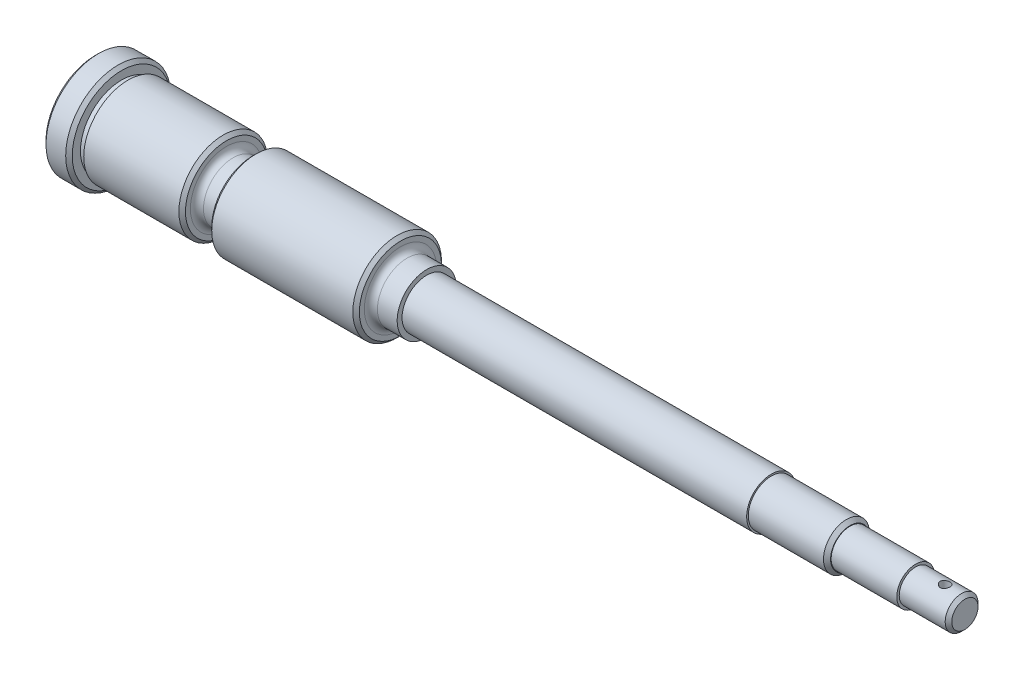
from build123d import *

# Parameters (mm, degrees)
CHAMFER_1_SIZE = 1
FILLET_1_R     = 2
FILLET_2_R     = 2


# Read off the part's stored shape, not the designer's step: M14 机械螺纹 螺柱1
with BuildPart() as part:
    # 草图1 → 旋转1 (revolve)
    with BuildSketch(Plane.XY, mode=Mode.PRIVATE) as revolve_1_sk:
        Polygon((0, 0), (0, 16), (8, 16), (8, 12.5), (10, 12.5), (10, 13.5), (40, 13.5), (40, 9), (48, 9), (48, 13.5), (93, 13.5), (93, 9), (101, 9), (101, 7.5), (230, 7.5), (230, 5.75), (250, 5.75), (250, 5), (265, 5), (265, 0), align=None)
    revolve(revolve_1_sk.sketch.rotate(Axis((0, 0, 0), (1, 0, 0)), 90), axis=Axis((0, 0, 0), (1, 0, 0)))

    # M14 机械螺纹 螺柱1 outline → M14 机械螺纹 螺柱1 (revolve, cut)
    with BuildSketch(Plane.YX):
        Polygon((7.5, 230), (5.9175, 230), (7, 228.9175), (7, 206), (7.5, 206), align=None)
    revolve(axis=Axis((0, 0, 0), (1, 0, 0)), mode=Mode.SUBTRACT)

    # 草图3 → 切除-旋转1 (revolve, cut)
    with BuildSketch(Plane.XY, mode=Mode.PRIVATE) as cut_revolve_1_sk:
        Polygon((259, -5.697872022), (260.4, -5.697872022), (260.5, 5.677594139), (259, 5.677594139), align=None)
    revolve(cut_revolve_1_sk.sketch.rotate(Axis((259, -22.643842163, 0), (0, 1, 0)), 131.522767303), axis=Axis((259, -22.643842163, 0), (0, 1, 0)), mode=Mode.SUBTRACT)

    # 倒角1
    chamfer_1_edges = [part.edges().sort_by_distance(p)[0] for p in [
        (265, 0, -5),
        (93, 0, -13.5),
        (48, 0, -13.5),
        (40, 0, -13.5),
        (8, 0, -16),
        (0, 0, -16),
    ]]
    chamfer(chamfer_1_edges, length=CHAMFER_1_SIZE)

    # 圆角1
    fillet_1_edges = [part.edges().sort_by_distance(p)[0] for p in [
        (48, 0, -9),
        (40, 0, -9),
    ]]
    fillet(fillet_1_edges, radius=FILLET_1_R)

    # 圆角2
    fillet_2_edges = [part.edges().sort_by_distance(p)[0] for p in [
        (93, 0, -9),
    ]]
    fillet(fillet_2_edges, radius=FILLET_2_R)


solid = part.part
